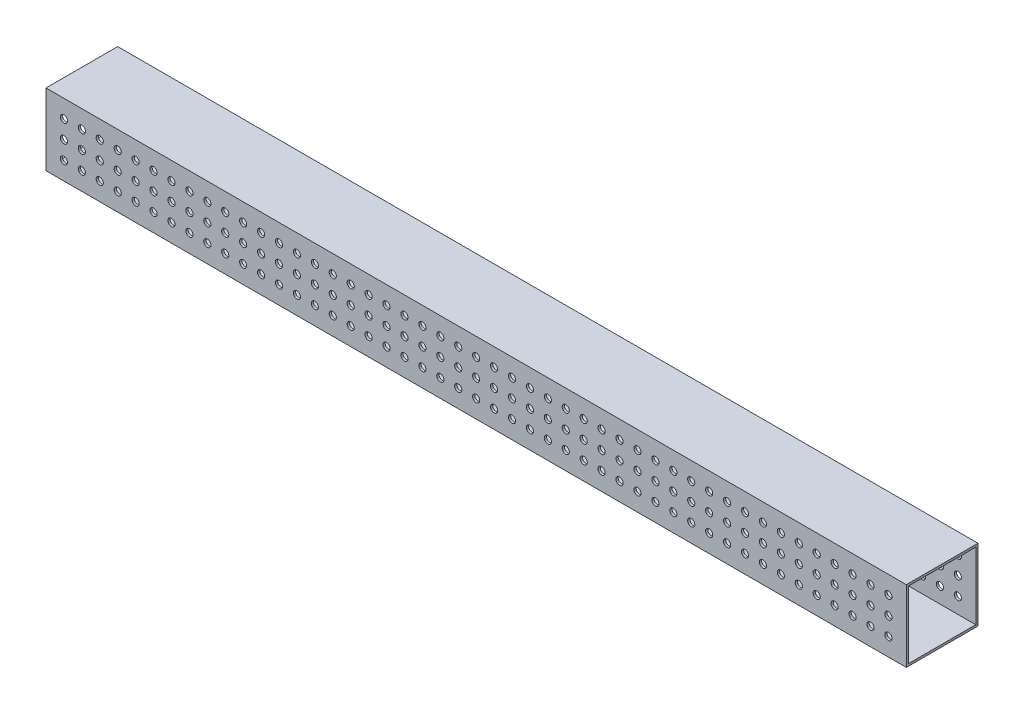
from build123d import *

# Parameters (mm, degrees)
SKETCH1_W           = 50.8
SKETCH1_H           = 50.8
SKETCH1_W_2         = 47.625
SKETCH1_H_2         = 47.625
BOSS_EXTRUDE1_DEPTH = 609.6
SKETCH2_R           = 2.54
CUT_EXTRUDE2_DEPTH  = 609.6


with BuildPart() as part:
    # Sketch1 → Boss-Extrude1 (new body)
    with BuildSketch(Plane(origin=(0, 0, 0), x_dir=(0, 0, -1), z_dir=(1, 0, 0))):
        Rectangle(SKETCH1_W, SKETCH1_H)
        Rectangle(SKETCH1_W_2, SKETCH1_H_2, mode=Mode.SUBTRACT)
    extrude(amount=BOSS_EXTRUDE1_DEPTH)

    # Sketch2 → Cut-Extrude2 (cut)
    with BuildSketch(Plane.XY.offset(25.4)):
        with Locations((12.7, 12.7)):
            Circle(SKETCH2_R)
        with Locations((12.7, 0)):
            Circle(SKETCH2_R)
        with Locations((12.7, -12.7)):
            Circle(SKETCH2_R)
        with Locations((25.4, 12.7)):
            Circle(SKETCH2_R)
        with Locations((25.4, 0)):
            Circle(SKETCH2_R)
        with Locations((25.4, -12.7)):
            Circle(SKETCH2_R)
        with Locations((38.1, 12.7)):
            Circle(SKETCH2_R)
        with Locations((38.1, 0)):
            Circle(SKETCH2_R)
        with Locations((38.1, -12.7)):
            Circle(SKETCH2_R)
        with Locations((50.8, 12.7)):
            Circle(SKETCH2_R)
        with Locations((50.8, 0)):
            Circle(SKETCH2_R)
        with Locations((50.8, -12.7)):
            Circle(SKETCH2_R)
        with Locations((63.5, 12.7)):
            Circle(SKETCH2_R)
        with Locations((63.5, 0)):
            Circle(SKETCH2_R)
        with Locations((63.5, -12.7)):
            Circle(SKETCH2_R)
        with Locations((76.2, 12.7)):
            Circle(SKETCH2_R)
        with Locations((76.2, 0)):
            Circle(SKETCH2_R)
        with Locations((76.2, -12.7)):
            Circle(SKETCH2_R)
        with Locations((88.9, 12.7)):
            Circle(SKETCH2_R)
        with Locations((88.9, 0)):
            Circle(SKETCH2_R)
        with Locations((88.9, -12.7)):
            Circle(SKETCH2_R)
        with Locations((101.6, 12.7)):
            Circle(SKETCH2_R)
        with Locations((101.6, 0)):
            Circle(SKETCH2_R)
        with Locations((101.6, -12.7)):
            Circle(SKETCH2_R)
        with Locations((114.3, 12.7)):
            Circle(SKETCH2_R)
        with Locations((114.3, 0)):
            Circle(SKETCH2_R)
        with Locations((114.3, -12.7)):
            Circle(SKETCH2_R)
        with Locations((127, 12.7)):
            Circle(SKETCH2_R)
        with Locations((127, 0)):
            Circle(SKETCH2_R)
        with Locations((127, -12.7)):
            Circle(SKETCH2_R)
        with Locations((139.7, 12.7)):
            Circle(SKETCH2_R)
        with Locations((139.7, 0)):
            Circle(SKETCH2_R)
        with Locations((139.7, -12.7)):
            Circle(SKETCH2_R)
        with Locations((152.4, 12.7)):
            Circle(SKETCH2_R)
        with Locations((152.4, 0)):
            Circle(SKETCH2_R)
        with Locations((152.4, -12.7)):
            Circle(SKETCH2_R)
        with Locations((165.1, 12.7)):
            Circle(SKETCH2_R)
        with Locations((165.1, 0)):
            Circle(SKETCH2_R)
        with Locations((165.1, -12.7)):
            Circle(SKETCH2_R)
        with Locations((177.8, 12.7)):
            Circle(SKETCH2_R)
        with Locations((177.8, 0)):
            Circle(SKETCH2_R)
        with Locations((177.8, -12.7)):
            Circle(SKETCH2_R)
        with Locations((190.5, 12.7)):
            Circle(SKETCH2_R)
        with Locations((190.5, 0)):
            Circle(SKETCH2_R)
        with Locations((190.5, -12.7)):
            Circle(SKETCH2_R)
        with Locations((203.2, 12.7)):
            Circle(SKETCH2_R)
        with Locations((203.2, 0)):
            Circle(SKETCH2_R)
        with Locations((203.2, -12.7)):
            Circle(SKETCH2_R)
        with Locations((215.9, 12.7)):
            Circle(SKETCH2_R)
        with Locations((215.9, 0)):
            Circle(SKETCH2_R)
        with Locations((215.9, -12.7)):
            Circle(SKETCH2_R)
        with Locations((228.6, 12.7)):
            Circle(SKETCH2_R)
        with Locations((228.6, 0)):
            Circle(SKETCH2_R)
        with Locations((228.6, -12.7)):
            Circle(SKETCH2_R)
        with Locations((241.3, 12.7)):
            Circle(SKETCH2_R)
        with Locations((241.3, 0)):
            Circle(SKETCH2_R)
        with Locations((241.3, -12.7)):
            Circle(SKETCH2_R)
        with Locations((254, 12.7)):
            Circle(SKETCH2_R)
        with Locations((254, 0)):
            Circle(SKETCH2_R)
        with Locations((254, -12.7)):
            Circle(SKETCH2_R)
        with Locations((266.7, 12.7)):
            Circle(SKETCH2_R)
        with Locations((266.7, 0)):
            Circle(SKETCH2_R)
        with Locations((266.7, -12.7)):
            Circle(SKETCH2_R)
        with Locations((279.4, 12.7)):
            Circle(SKETCH2_R)
        with Locations((279.4, 0)):
            Circle(SKETCH2_R)
        with Locations((279.4, -12.7)):
            Circle(SKETCH2_R)
        with Locations((292.1, 12.7)):
            Circle(SKETCH2_R)
        with Locations((292.1, 0)):
            Circle(SKETCH2_R)
        with Locations((292.1, -12.7)):
            Circle(SKETCH2_R)
        with Locations((304.8, 12.7)):
            Circle(SKETCH2_R)
        with Locations((304.8, 0)):
            Circle(SKETCH2_R)
        with Locations((304.8, -12.7)):
            Circle(SKETCH2_R)
        with Locations((317.5, 12.7)):
            Circle(SKETCH2_R)
        with Locations((317.5, 0)):
            Circle(SKETCH2_R)
        with Locations((317.5, -12.7)):
            Circle(SKETCH2_R)
        with Locations((330.2, 12.7)):
            Circle(SKETCH2_R)
        with Locations((330.2, 0)):
            Circle(SKETCH2_R)
        with Locations((330.2, -12.7)):
            Circle(SKETCH2_R)
        with Locations((342.9, 12.7)):
            Circle(SKETCH2_R)
        with Locations((342.9, 0)):
            Circle(SKETCH2_R)
        with Locations((342.9, -12.7)):
            Circle(SKETCH2_R)
        with Locations((355.6, 12.7)):
            Circle(SKETCH2_R)
        with Locations((355.6, 0)):
            Circle(SKETCH2_R)
        with Locations((355.6, -12.7)):
            Circle(SKETCH2_R)
        with Locations((368.3, 12.7)):
            Circle(SKETCH2_R)
        with Locations((368.3, 0)):
            Circle(SKETCH2_R)
        with Locations((368.3, -12.7)):
            Circle(SKETCH2_R)
        with Locations((381, 12.7)):
            Circle(SKETCH2_R)
        with Locations((381, 0)):
            Circle(SKETCH2_R)
        with Locations((381, -12.7)):
            Circle(SKETCH2_R)
        with Locations((393.7, 12.7)):
            Circle(SKETCH2_R)
        with Locations((393.7, 0)):
            Circle(SKETCH2_R)
        with Locations((393.7, -12.7)):
            Circle(SKETCH2_R)
        with Locations((406.4, 12.7)):
            Circle(SKETCH2_R)
        with Locations((406.4, 0)):
            Circle(SKETCH2_R)
        with Locations((406.4, -12.7)):
            Circle(SKETCH2_R)
        with Locations((419.1, 12.7)):
            Circle(SKETCH2_R)
        with Locations((419.1, 0)):
            Circle(SKETCH2_R)
        with Locations((419.1, -12.7)):
            Circle(SKETCH2_R)
        with Locations((431.8, 12.7)):
            Circle(SKETCH2_R)
        with Locations((431.8, 0)):
            Circle(SKETCH2_R)
        with Locations((431.8, -12.7)):
            Circle(SKETCH2_R)
        with Locations((444.5, 12.7)):
            Circle(SKETCH2_R)
        with Locations((444.5, 0)):
            Circle(SKETCH2_R)
        with Locations((444.5, -12.7)):
            Circle(SKETCH2_R)
        with Locations((457.2, 12.7)):
            Circle(SKETCH2_R)
        with Locations((457.2, 0)):
            Circle(SKETCH2_R)
        with Locations((457.2, -12.7)):
            Circle(SKETCH2_R)
        with Locations((469.9, 12.7)):
            Circle(SKETCH2_R)
        with Locations((469.9, 0)):
            Circle(SKETCH2_R)
        with Locations((469.9, -12.7)):
            Circle(SKETCH2_R)
        with Locations((482.6, 12.7)):
            Circle(SKETCH2_R)
        with Locations((482.6, 0)):
            Circle(SKETCH2_R)
        with Locations((482.6, -12.7)):
            Circle(SKETCH2_R)
        with Locations((495.3, 12.7)):
            Circle(SKETCH2_R)
        with Locations((495.3, 0)):
            Circle(SKETCH2_R)
        with Locations((495.3, -12.7)):
            Circle(SKETCH2_R)
        with Locations((508, 12.7)):
            Circle(SKETCH2_R)
        with Locations((508, 0)):
            Circle(SKETCH2_R)
        with Locations((508, -12.7)):
            Circle(SKETCH2_R)
        with Locations((520.7, 12.7)):
            Circle(SKETCH2_R)
        with Locations((520.7, 0)):
            Circle(SKETCH2_R)
        with Locations((520.7, -12.7)):
            Circle(SKETCH2_R)
        with Locations((533.4, 12.7)):
            Circle(SKETCH2_R)
        with Locations((533.4, 0)):
            Circle(SKETCH2_R)
        with Locations((533.4, -12.7)):
            Circle(SKETCH2_R)
        with Locations((546.1, 12.7)):
            Circle(SKETCH2_R)
        with Locations((546.1, 0)):
            Circle(SKETCH2_R)
        with Locations((546.1, -12.7)):
            Circle(SKETCH2_R)
        with Locations((558.8, 12.7)):
            Circle(SKETCH2_R)
        with Locations((558.8, 0)):
            Circle(SKETCH2_R)
        with Locations((558.8, -12.7)):
            Circle(SKETCH2_R)
        with Locations((571.5, 12.7)):
            Circle(SKETCH2_R)
        with Locations((571.5, 0)):
            Circle(SKETCH2_R)
        with Locations((571.5, -12.7)):
            Circle(SKETCH2_R)
        with Locations((584.2, 12.7)):
            Circle(SKETCH2_R)
        with Locations((584.2, 0)):
            Circle(SKETCH2_R)
        with Locations((584.2, -12.7)):
            Circle(SKETCH2_R)
        with Locations((596.9, 12.7)):
            Circle(SKETCH2_R)
        with Locations((596.9, 0)):
            Circle(SKETCH2_R)
        with Locations((596.9, -12.7)):
            Circle(SKETCH2_R)
    extrude(amount=-CUT_EXTRUDE2_DEPTH, mode=Mode.SUBTRACT)


solid = part.part
